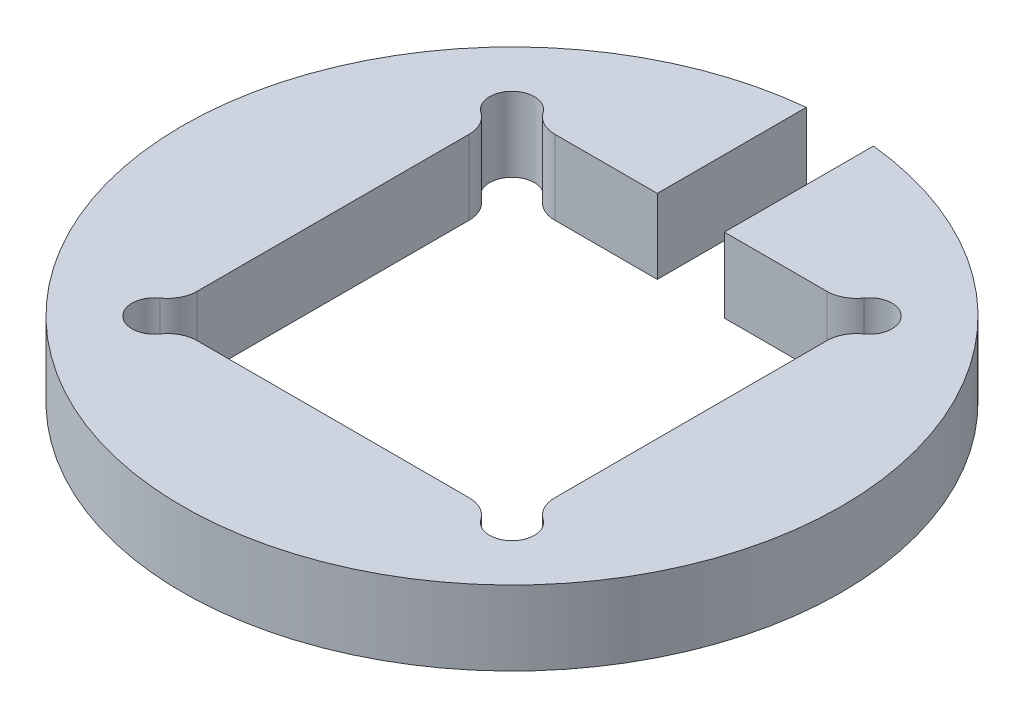
from build123d import *

# Parameters (mm, degrees)
BOSS_EXTRUDE1_DEPTH = 5
FILLET1_R           = 2


with BuildPart() as part:
    # Sketch1 → Boss-Extrude1 (new body)
    with BuildSketch(Plane(origin=(0, 0, 0), x_dir=(1, 0, 0), z_dir=(0, 1, 0))):
        with BuildLine():
            ThreePointArc((1.5, 0), (-1.060660172, -1.060660172), (0, 1.5))
            Line((0, 1.5), (0, 22.5))
            ThreePointArc((0, 22.5), (-1.060660172, 25.060660172), (1.5, 24))
            Line((1.5, 24), (9.75, 24))
            Line((9.75, 24), (9.75, 34))
            ThreePointArc((9.75, 34), (12, -10.114757516), (14.25, 34))
            Line((14.25, 34), (14.25, 24))
            Line((14.25, 24), (22.5, 24))
            ThreePointArc((22.5, 24), (25.060660172, 25.060660172), (24, 22.5))
            Line((24, 22.5), (24, 1.5))
            ThreePointArc((24, 1.5), (25.060660172, -1.060660172), (22.5, 0))
            Line((22.5, 0), (1.5, 0))
        make_face()
    extrude(amount=BOSS_EXTRUDE1_DEPTH)

    # Fillet1
    fillet1_edges = [part.edges().sort_by_distance(p)[0] for p in [
        (22.5, 2.5, 0),
        (24, 2.5, -1.5),
        (24, 2.5, -22.5),
        (0, 2.5, -1.5),
        (1.5, 2.5, 0),
        (0, 2.5, -22.5),
        (22.5, 2.5, -24),
        (1.5, 2.5, -24),
    ]]
    fillet(fillet1_edges, radius=FILLET1_R)


solid = part.part
